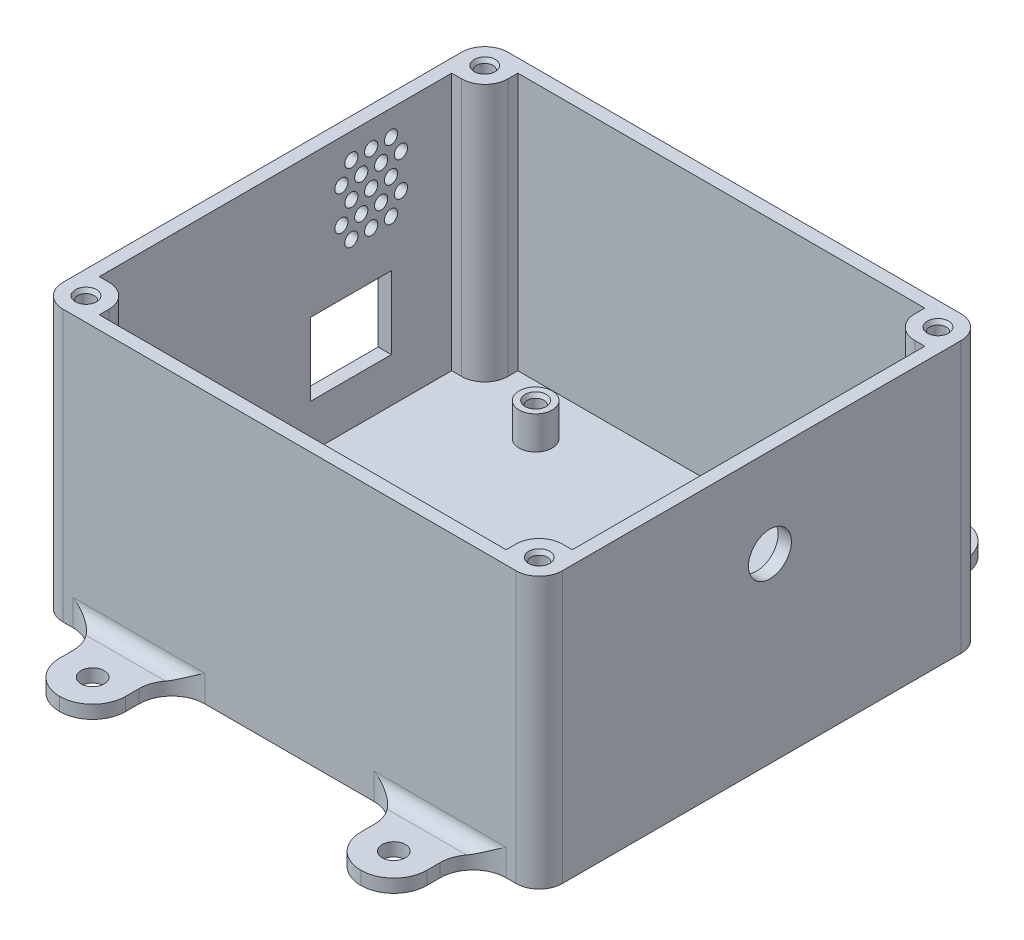
from build123d import *

# Parameters (mm, degrees)
BOSS_EXTRU_1_DEPTH                                  = 41
ENL_V_MAT_EXTRU_2_DEPTH                             = 39
ESQUISSE3_R                                         = 2.4999999999999982
ESQUISSE3_R_2                                       = 2.5000000000000018
ESQUISSE3_R_3                                       = 2.5000000000000027
BOSS_EXTRU_2_DEPTH                                  = 5
TROU_POUR_TARAUDAGE_POUR_TROU_TARAUD_M3_D           = 2.5
TROU_POUR_TARAUDAGE_POUR_TROU_TARAUD_M3_DEPTH       = 10
TROU_POUR_TARAUDAGE_POUR_TROU_TARAUD_M3_CSINK_D     = 3.2
TROU_POUR_TARAUDAGE_POUR_TROU_TARAUD_M3_CSINK_ANGLE = 60
TROU_POUR_TARAUDAGE_POUR_TROU_TARAUD_M3_TIP         = 0.7510757737844503
TROU_POUR_TARAUDAGE_POUR_TROU_TARAUD_2_D            = 2.5
TROU_POUR_TARAUDAGE_POUR_TROU_TARAUD_2_DEPTH        = 5
TROU_POUR_TARAUDAGE_POUR_TROU_TARAUD_2_CSINK_D      = 3.2
TROU_POUR_TARAUDAGE_POUR_TROU_TARAUD_2_CSINK_ANGLE  = 60
TROU_POUR_TARAUDAGE_POUR_TROU_TARAUD_2_TIP          = 0.7510757737844503
ESQUISSE10_R                                        = 1.7500000000000004
ESQUISSE10_W                                        = 10.000000000000004
ESQUISSE10_H                                        = 11.999999999999986
ESQUISSE10_W_2                                      = 9.999999999999993
ESQUISSE10_H_2                                      = 12
BOSS_EXTRU_3_DEPTH                                  = 2
CONG_1_START                                        = -1
CONG_1_DEPTH                                        = 3
CONG_1_2_DEPTH                                      = 2
CONG_2_R                                            = 2
CONG_3_R                                            = 3.5
ENL_V_MAT_EXTRU_3_REACH                             = 99.361
ESQUISSE11_R                                        = 3.2499999999999996
ENL_V_MAT_EXTRU_4_REACH                             = 99.361
ENL_V_MAT_EXTRU_5_REACH                             = 99.361
ESQUISSE14_R                                        = 1.0000000000000018
R_P_TITION_START                                    = -36.29
R_P_TITION_DANS_UNE_ZONE1_OUTLINE_R                 = 1
R_P_TITION_DANS_UNE_ZONE1_DEPTH                     = 2


with BuildPart() as part:
    # Esquisse1 → Boss.-Extru.1 (new body)
    with BuildSketch(Plane(origin=(0, 0, 0), x_dir=(1, 0, 0), z_dir=(0, 1, 0))):
        Polygon((-36.29, -33.67), (-36.290000000000006, 33.67), (39.28999999999998, 33.67), (39.289999999999985, -33.669999999999995), align=None)
    extrude(amount=BOSS_EXTRU_1_DEPTH)

    # Esquisse2 → Enlèv. mat.-Extru.2 (cut)
    with BuildSketch(Plane(origin=(0, 41, 0), x_dir=(1, 0, 0), z_dir=(0, 1, 0))):
        with BuildLine():
            Line((-29.29, 31.669999999999998), (32.289999999999985, 31.669999999999998))
            Line((32.289999999999985, 31.669999999999998), (32.289999999999985, 30.169999999999995))
            ThreePointArc((32.289999999999985, 30.169999999999995), (33.31512626584707, 27.695126265847072), (35.78999999999999, 26.669999999999995))
            Line((35.78999999999999, 26.669999999999995), (37.28999999999999, 26.669999999999995))
            Line((37.28999999999999, 26.669999999999995), (37.29, -26.669999999999987))
            Line((37.29, -26.669999999999987), (35.78999999999999, -26.669999999999984))
            ThreePointArc((35.78999999999999, -26.669999999999984), (33.315126265847084, -27.695126265847076), (32.29, -30.169999999999987))
            Line((32.29, -30.169999999999987), (32.29, -31.66999999999999))
            Line((32.29, -31.66999999999999), (-29.29, -31.669999999999998))
            Line((-29.29, -31.669999999999998), (-29.290000000000003, -30.169999999999995))
            ThreePointArc((-29.290000000000003, -30.169999999999995), (-30.31512626584708, -27.69512626584708), (-32.79, -26.669999999999995))
            Line((-32.79, -26.669999999999995), (-34.29, -26.669999999999995))
            Line((-34.29, -26.669999999999995), (-34.29, 26.669999999999995))
            Line((-34.29, 26.669999999999995), (-32.79, 26.669999999999998))
            ThreePointArc((-32.79, 26.669999999999998), (-30.315126265847084, 27.69512626584708), (-29.29, 30.169999999999995))
            Line((-29.29, 30.169999999999995), (-29.29, 31.669999999999998))
        make_face()
    extrude(amount=-ENL_V_MAT_EXTRU_2_DEPTH, mode=Mode.SUBTRACT)

    # Esquisse3 → Boss.-Extru.2 (add)
    with BuildSketch(Plane(origin=(0, 2, 0), x_dir=(1, 0, 0), z_dir=(0, 1, 0))):
        with Locations(Location((-19.050000000000004, 24.130000000000003, 0), (0, 0, 90))):
            Circle(ESQUISSE3_R)
        with Locations(Location((31.749999999999986, 8.890000000000013, 0), (0, 0, 90))):
            Circle(ESQUISSE3_R_2)
        with Locations(Location((31.749999999999986, -19.049999999999986, 0), (0, 0, 90))):
            Circle(ESQUISSE3_R_3)
        with Locations(Location((-20.320000000000004, -24.129999999999985, 0), (0, 0, 90))):
            Circle(ESQUISSE3_R)
    extrude(amount=BOSS_EXTRU_2_DEPTH)

    # Trou pour taraudage pour trou taraud_ M3
    with Locations(Plane(origin=(0, 41, 0), x_dir=(1, 0, 0), z_dir=(0, 1, 0))):
        with Locations((-32.79, 30.17), (35.79, 30.17), (35.79, -30.17), (-32.79, -30.17)):
            CounterSinkHole(TROU_POUR_TARAUDAGE_POUR_TROU_TARAUD_M3_D / 2, TROU_POUR_TARAUDAGE_POUR_TROU_TARAUD_M3_CSINK_D / 2, depth=TROU_POUR_TARAUDAGE_POUR_TROU_TARAUD_M3_DEPTH, counter_sink_angle=TROU_POUR_TARAUDAGE_POUR_TROU_TARAUD_M3_CSINK_ANGLE)
            with Locations((0, 0, -(TROU_POUR_TARAUDAGE_POUR_TROU_TARAUD_M3_DEPTH + TROU_POUR_TARAUDAGE_POUR_TROU_TARAUD_M3_TIP / 2))):  # 118° drill point
                Cone(0, TROU_POUR_TARAUDAGE_POUR_TROU_TARAUD_M3_D / 2, TROU_POUR_TARAUDAGE_POUR_TROU_TARAUD_M3_TIP, mode=Mode.SUBTRACT)

    # Trou pour taraudage pour trou taraud 2
    with Locations(Plane(origin=(0, 7, 0), x_dir=(1, 0, 0), z_dir=(0, 1, 0))):
        with Locations((-19.05, 24.13), (31.75, 8.89), (31.75, -19.05), (-20.32, -24.13)):
            CounterSinkHole(TROU_POUR_TARAUDAGE_POUR_TROU_TARAUD_2_D / 2, TROU_POUR_TARAUDAGE_POUR_TROU_TARAUD_2_CSINK_D / 2, depth=TROU_POUR_TARAUDAGE_POUR_TROU_TARAUD_2_DEPTH, counter_sink_angle=TROU_POUR_TARAUDAGE_POUR_TROU_TARAUD_2_CSINK_ANGLE)
            with Locations((0, 0, -(TROU_POUR_TARAUDAGE_POUR_TROU_TARAUD_2_DEPTH + TROU_POUR_TARAUDAGE_POUR_TROU_TARAUD_2_TIP / 2))):  # 118° drill point
                Cone(0, TROU_POUR_TARAUDAGE_POUR_TROU_TARAUD_2_D / 2, TROU_POUR_TARAUDAGE_POUR_TROU_TARAUD_2_TIP, mode=Mode.SUBTRACT)

    # Esquisse10 → Boss.-Extru.3 (add)
    # profile 1 of 4: a face of its own
    with BuildSketch(Plane(origin=(0, 0, 0), x_dir=(1, 0, 0), z_dir=(0, 1, 0))):
        Polygon((29.289999999999967, 33.67), (29.289999999999974, 45.669999999999995), (19.289999999999974, 45.67), (19.289999999999974, 33.67), align=None)
        with Locations(Location((24.289999999999974, 40.669999999999995, 0), (0, 0, 270))):
            Circle(ESQUISSE10_R, mode=Mode.SUBTRACT)
    # profile 2 of 4: a face of its own
    with BuildSketch(Plane(origin=(0, 0, 0), x_dir=(1, 0, 0), z_dir=(0, 1, 0))):
        with Locations((-21.289999999999992, 39.669999999999995)):
            Rectangle(ESQUISSE10_W, ESQUISSE10_H)
        with Locations(Location((-21.28999999999999, 40.67, 0), (0, 0, 270))):
            Circle(ESQUISSE10_R, mode=Mode.SUBTRACT)
    # profile 3 of 4: a face of its own
    with BuildSketch(Plane(origin=(0, 0, 0), x_dir=(1, 0, 0), z_dir=(0, 1, 0))):
        with Locations((-21.28999999999999, -39.669999999999995)):
            Rectangle(ESQUISSE10_W_2, ESQUISSE10_H_2)
        with Locations(Location((-21.28999999999998, -40.669999999999995, 0), (0, 0, 270))):
            Circle(ESQUISSE10_R, mode=Mode.SUBTRACT)
    # profile 4 of 4: a face of its own
    with BuildSketch(Plane(origin=(0, 0, 0), x_dir=(1, 0, 0), z_dir=(0, 1, 0))):
        Polygon((29.289999999999978, -33.669999999999995), (29.28999999999998, -45.66999999999998), (19.28999999999999, -45.66999999999998), (19.289999999999985, -33.669999999999995), align=None)
        with Locations(Location((24.289999999999974, -40.66999999999999, 0), (0, 0, 270))):
            Circle(ESQUISSE10_R, mode=Mode.SUBTRACT)
    extrude(amount=BOSS_EXTRU_3_DEPTH)

    # Congé1: read off the stored shape, not the designer's step
    # Congé1 outline → Congé1 (cut)
    with BuildSketch(Plane(origin=(0, 0, 0), x_dir=(1, 0, 0), z_dir=(0, 1, 0)).offset(CONG_1_START)):
        with BuildLine():
            Line((19.29, 45.67), (19.29, 40.67))
            ThreePointArc((19.29, 40.67), (20.754466094, 44.205533906), (24.29, 45.67))
            Line((24.29, 45.67), (19.29, 45.67))
        make_face()
        with BuildLine():
            Line((29.29, 45.67), (24.29, 45.67))
            ThreePointArc((24.29, 45.67), (27.825533906, 44.205533906), (29.29, 40.67))
            Line((29.29, 40.67), (29.29, 45.67))
        make_face()
        with BuildLine():
            ThreePointArc((-21.29, 45.67), (-17.754466094, 44.205533906), (-16.29, 40.67))
            Line((-16.29, 40.67), (-16.29, 45.67))
            Line((-16.29, 45.67), (-21.29, 45.67))
        make_face()
        with BuildLine():
            ThreePointArc((-26.29, 40.67), (-24.825533906, 44.205533906), (-21.29, 45.67))
            Line((-21.29, 45.67), (-26.29, 45.67))
            Line((-26.29, 45.67), (-26.29, 40.67))
        make_face()
        with BuildLine():
            Line((29.29, -45.67), (29.29, -40.67))
            ThreePointArc((29.29, -40.67), (27.825533906, -44.205533906), (24.29, -45.67))
            Line((24.29, -45.67), (29.29, -45.67))
        make_face()
        with BuildLine():
            Line((19.29, -45.67), (24.29, -45.67))
            ThreePointArc((24.29, -45.67), (20.754466094, -44.205533906), (19.29, -40.67))
            Line((19.29, -40.67), (19.29, -45.67))
        make_face()
        with BuildLine():
            Line((-16.29, -45.67), (-16.29, -40.67))
            ThreePointArc((-16.29, -40.67), (-17.754466094, -44.205533906), (-21.29, -45.67))
            Line((-21.29, -45.67), (-16.29, -45.67))
        make_face()
        with BuildLine():
            Line((-26.29, -45.67), (-21.29, -45.67))
            ThreePointArc((-21.29, -45.67), (-24.825533906, -44.205533906), (-26.29, -40.67))
            Line((-26.29, -40.67), (-26.29, -45.67))
        make_face()
    extrude(amount=CONG_1_DEPTH, mode=Mode.SUBTRACT)

    # Cong_1 2 outline → Cong_1 2 (add)
    with BuildSketch(Plane(origin=(0, 0, 0), x_dir=(1, 0, 0), z_dir=(0, 1, 0))):
        with BuildLine():
            Line((-16.29, 33.67), (-11.29, 33.67))
            ThreePointArc((-11.29, 33.67), (-14.825533906, 35.134466094), (-16.29, 38.67))
            Line((-16.29, 38.67), (-16.29, 33.67))
        make_face()
        with BuildLine():
            ThreePointArc((19.29, 38.67), (17.825533906, 35.134466094), (14.29, 33.67))
            Line((14.29, 33.67), (19.29, 33.67))
            Line((19.29, 33.67), (19.29, 38.67))
        make_face()
        with BuildLine():
            Line((29.29, 38.67), (29.29, 33.67))
            Line((29.29, 33.67), (34.29, 33.67))
            ThreePointArc((34.29, 33.67), (30.754466094, 35.134466094), (29.29, 38.67))
        make_face()
        with BuildLine():
            Line((-31.29, 33.67), (-26.29, 33.67))
            Line((-26.29, 33.67), (-26.29, 38.67))
            ThreePointArc((-26.29, 38.67), (-27.754466094, 35.134466094), (-31.29, 33.67))
        make_face()
        with BuildLine():
            ThreePointArc((-16.29, -38.67), (-14.825533906, -35.134466094), (-11.29, -33.67))
            Line((-11.29, -33.67), (-16.29, -33.67))
            Line((-16.29, -33.67), (-16.29, -38.67))
        make_face()
        with BuildLine():
            ThreePointArc((29.29, -38.67), (30.754466094, -35.134466094), (34.29, -33.67))
            Line((34.29, -33.67), (29.29, -33.67))
            Line((29.29, -33.67), (29.29, -38.67))
        make_face()
        with BuildLine():
            Line((19.29, -38.67), (19.29, -33.67))
            Line((19.29, -33.67), (14.29, -33.67))
            ThreePointArc((14.29, -33.67), (17.825533906, -35.134466094), (19.29, -38.67))
        make_face()
        with BuildLine():
            Line((-26.29, -38.67), (-26.29, -33.67))
            Line((-26.29, -33.67), (-31.29, -33.67))
            ThreePointArc((-31.29, -33.67), (-27.754466094, -35.134466094), (-26.29, -38.67))
        make_face()
    extrude(amount=CONG_1_2_DEPTH)

    # Congé2
    cong_2_edges = [part.edges().sort_by_distance(p)[0] for p in [
        (24.29, 2, -33.67),
        (-21.29, 2, -33.67),
        (-21.29, 2, 33.67),
        (24.29, 2, 33.67),
    ]]
    fillet(cong_2_edges, radius=CONG_2_R)

    # Congé3
    cong_3_edges = [part.edges().sort_by_distance(p)[0] for p in [
        (-36.29, 20.5, 33.67),
        (-36.290000000000006, 20.5, -33.67),
        (39.28999999999998, 20.5, -33.67),
        (39.289999999999985, 20.5, 33.669999999999995),
    ]]
    fillet(cong_3_edges, radius=CONG_3_R)

    # Esquisse11 → Enlèv. mat.-Extru.3 (cut, up to next)
    with BuildSketch(Plane(origin=(39.289999999999985, 0, -4.05e-15), x_dir=(-1e-16, 0, -1), z_dir=(1, 0, -1e-16)), mode=Mode.PRIVATE) as enl_v_mat_extru_3_sk1:
        with Locations((1.239999999999991, 27.5)):
            Circle(ESQUISSE11_R)
    enl_v_mat_extru_3_tool1 = extrude(enl_v_mat_extru_3_sk1.sketch, amount=-ENL_V_MAT_EXTRU_3_REACH, mode=Mode.PRIVATE) & part.part
    add(enl_v_mat_extru_3_tool1.solids().sort_by_distance((39.29, 27.5, -1.24))[0], mode=Mode.SUBTRACT)

    # Esquisse12 → Enlèv. mat.-Extru.4 (cut, up to next)
    with BuildSketch(Plane.ZY.offset(36.290000000000006), mode=Mode.PRIVATE) as enl_v_mat_extru_4_sk1:
        Polygon((-17.53000000000001, 19.68), (-5.3300000000000045, 19.68), (-5.3300000000000045, 8.68), (-17.530000000000005, 8.68), align=None)
    enl_v_mat_extru_4_tool1 = extrude(enl_v_mat_extru_4_sk1.sketch, amount=-ENL_V_MAT_EXTRU_4_REACH, mode=Mode.PRIVATE) & part.part
    # Esquisse12 → Enlèv. mat.-Extru.4 (cut, up to next)
    with BuildSketch(Plane.ZY.offset(36.290000000000006), mode=Mode.PRIVATE) as enl_v_mat_extru_4_sk2:
        Polygon((14.604999999999993, 19.68), (23.49499999999999, 19.68), (23.494999999999994, 8.68), (14.604999999999995, 8.68), align=None)
    enl_v_mat_extru_4_tool2 = extrude(enl_v_mat_extru_4_sk2.sketch, amount=-ENL_V_MAT_EXTRU_4_REACH, mode=Mode.PRIVATE) & part.part
    add(enl_v_mat_extru_4_tool1.solids().sort_by_distance((-36.29, 14.18, -11.43))[0], mode=Mode.SUBTRACT)
    add(enl_v_mat_extru_4_tool2.solids().sort_by_distance((-36.29, 14.18, 19.05))[0], mode=Mode.SUBTRACT)

    # Esquisse14 → Enlèv. mat.-Extru.5 (cut, up to next)
    with BuildSketch(Plane.ZY.offset(36.290000000000006), mode=Mode.PRIVATE) as enl_v_mat_extru_5_sk1:
        with Locations((-14.480000000000004, 32)):
            Circle(ESQUISSE14_R)
    enl_v_mat_extru_5_tool1 = extrude(enl_v_mat_extru_5_sk1.sketch, amount=-ENL_V_MAT_EXTRU_5_REACH, mode=Mode.PRIVATE) & part.part
    add(enl_v_mat_extru_5_tool1.solids().sort_by_distance((-36.29, 32, -14.48))[0], mode=Mode.SUBTRACT)

    # Répétition dans une zone1: read off the stored shape, not the designer's step
    # Répétition dans une zone1 outline → Répétition dans une zone1 (cut)
    with BuildSketch(Plane.YZ.offset(R_P_TITION_START)):
        with Locations((34.598076211, -18.98)):
            Circle(R_P_TITION_DANS_UNE_ZONE1_OUTLINE_R)
        with Locations((32, -11.48)):
            Circle(R_P_TITION_DANS_UNE_ZONE1_OUTLINE_R)
        with Locations((29.401923789, -12.98)):
            Circle(R_P_TITION_DANS_UNE_ZONE1_OUTLINE_R)
        with Locations((26.803847577, -14.48)):
            Circle(R_P_TITION_DANS_UNE_ZONE1_OUTLINE_R)
        with Locations((37.196152423, -11.48)):
            Circle(R_P_TITION_DANS_UNE_ZONE1_OUTLINE_R)
        with Locations((29.401923789, -9.98)):
            Circle(R_P_TITION_DANS_UNE_ZONE1_OUTLINE_R)
        with Locations((26.803847577, -11.48)):
            Circle(R_P_TITION_DANS_UNE_ZONE1_OUTLINE_R)
        with Locations((34.598076211, -9.98)):
            Circle(R_P_TITION_DANS_UNE_ZONE1_OUTLINE_R)
        with Locations((34.598076211, -15.98)):
            Circle(R_P_TITION_DANS_UNE_ZONE1_OUTLINE_R)
        with Locations((32, -17.48)):
            Circle(R_P_TITION_DANS_UNE_ZONE1_OUTLINE_R)
        with Locations((29.401923789, -18.98)):
            Circle(R_P_TITION_DANS_UNE_ZONE1_OUTLINE_R)
        with Locations((37.196152423, -17.48)):
            Circle(R_P_TITION_DANS_UNE_ZONE1_OUTLINE_R)
        with Locations((34.598076211, -12.98)):
            Circle(R_P_TITION_DANS_UNE_ZONE1_OUTLINE_R)
        with Locations((29.401923789, -15.98)):
            Circle(R_P_TITION_DANS_UNE_ZONE1_OUTLINE_R)
        with Locations((26.803847577, -17.48)):
            Circle(R_P_TITION_DANS_UNE_ZONE1_OUTLINE_R)
        with Locations((37.196152423, -14.48)):
            Circle(R_P_TITION_DANS_UNE_ZONE1_OUTLINE_R)
    extrude(amount=R_P_TITION_DANS_UNE_ZONE1_DEPTH, mode=Mode.SUBTRACT)


solid = part.part
